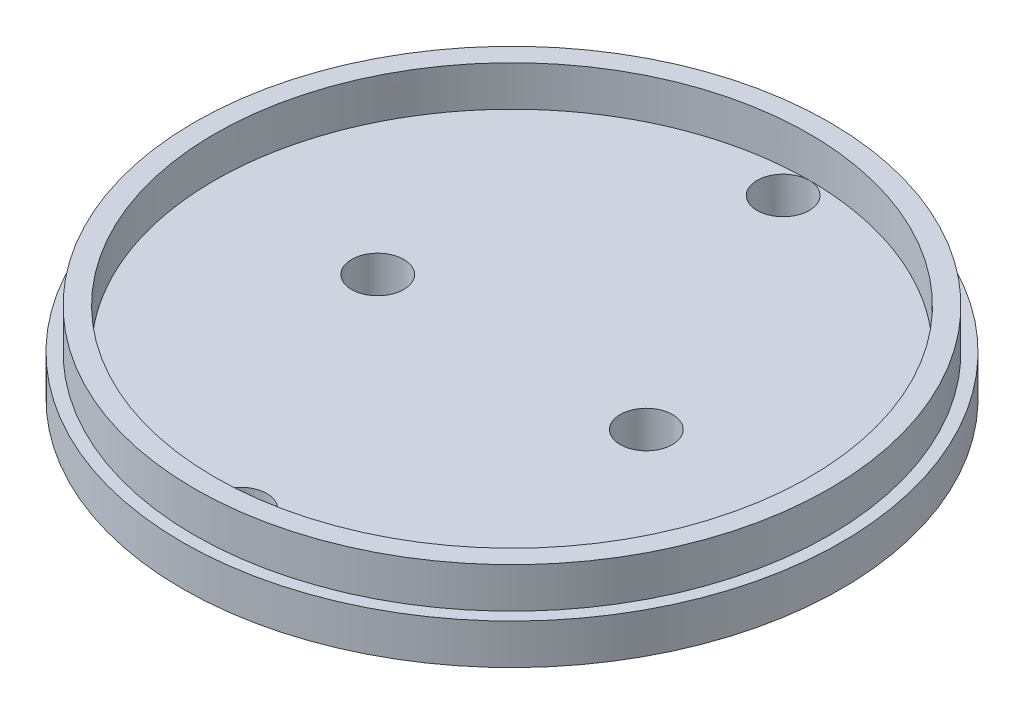
from build123d import *

# Parameters (mm, degrees)
SKETCH1_R               = 39.4
SKETCH1_R_2             = 36.9
BOSS_EXTRUDE1_DEPTH     = 5
SKETCH1_4_R             = 40.9
BOSS_EXTRUDE2_DEPTH     = 5
CUT_EXTRUDE1_DEPTH      = 59.699403745
CUT_EXTRUDE1_DEPTH_BACK = 59.699403745
SKETCH4_R               = 3.2385


with BuildPart() as part:
    # Sketch1 → Boss-Extrude1 (new body)
    with BuildSketch(Plane(origin=(0, 0, 0), x_dir=(1, 0, 0), z_dir=(0, 1, 0))):
        Circle(SKETCH1_R)
        Circle(SKETCH1_R_2, mode=Mode.SUBTRACT)
    extrude(amount=BOSS_EXTRUDE1_DEPTH)

    # Sketch1<4> → Boss-Extrude2 (add)
    with BuildSketch(Plane(origin=(0, 0, 0), x_dir=(1, 0, 0), z_dir=(0, 1, 0))):
        Circle(SKETCH1_4_R)
    extrude(amount=-BOSS_EXTRUDE2_DEPTH)

    # Sketch4 → Cut-Extrude1 (cut, two sides: drawn at the far end of the back side and taken through both)
    with BuildSketch(Plane.XZ.offset(5).offset(-CUT_EXTRUDE1_DEPTH_BACK)):
        with Locations((-16.66875, 0)):
            Circle(SKETCH4_R)
        with Locations((16.66875, 0)):
            Circle(SKETCH4_R)
        with Locations((0, 33.655)):
            Circle(SKETCH4_R)
        with Locations((0, -33.655)):
            Circle(SKETCH4_R)
    extrude(amount=CUT_EXTRUDE1_DEPTH + CUT_EXTRUDE1_DEPTH_BACK, mode=Mode.SUBTRACT)


solid = part.part
